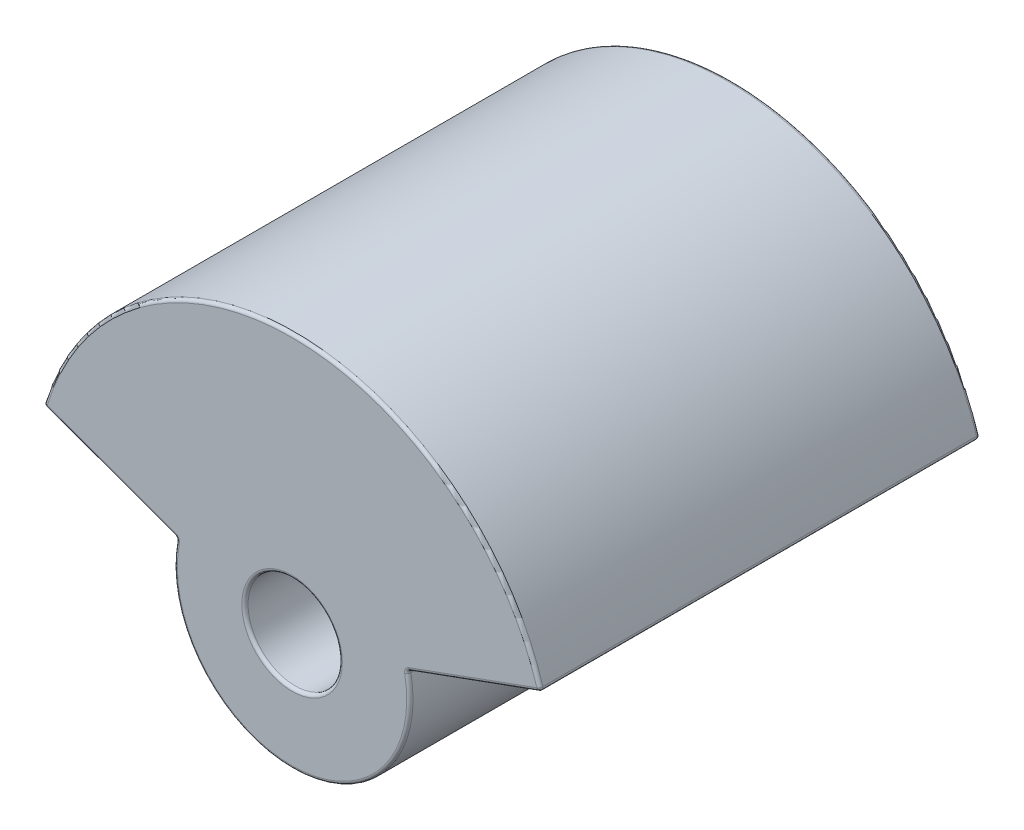
from build123d import *

# Parameters (mm, degrees)
SKETCH_1_R      = 0.3
EXTRUDE_1_DEPTH = 2.8
FILLET_2_R      = 0.02


with BuildPart() as part:
    # 草图1 → 凸台-拉伸1 (new body)
    with BuildSketch(Plane.XY):
        with BuildLine():
            Line((0.733236257, 0.157685102), (1.58258535, 0.46682289))
            ThreePointArc((1.58258535, 0.46682289), (0, 1.65), (-1.58258535, 0.46682289))
            Line((-1.58258535, 0.46682289), (-0.733236257, 0.157685102))
            ThreePointArc((-0.733236257, 0.157685102), (0, -0.75), (0.733236257, 0.157685102))
        make_face()
        Circle(SKETCH_1_R, mode=Mode.SUBTRACT)
    extrude(amount=-EXTRUDE_1_DEPTH)

    # 圆角2
    fillet_2_edges = [part.edges().sort_by_distance(p)[0] for p in [
        (0, -0.75, -2.8),
        (-0.733236257, 0.157685102, -1.4),
        (0, -0.75, 0),
        (1.58258535, 0.46682289, -1.4),
        (1.157910803, 0.312253996, -2.8),
        (0.733236257, 0.157685102, -1.4),
        (1.157910803, 0.312253996, 0),
        (-1.157910803, 0.312253996, 0),
        (-0.3, 0, 0),
        (-0.3, 0, -2.8),
        (0, 1.65, 0),
        (-1.58258535, 0.46682289, -1.4),
        (-1.157910803, 0.312253996, -2.8),
        (0, 1.65, -2.8),
    ]]
    fillet(fillet_2_edges, radius=FILLET_2_R)


solid = part.part
